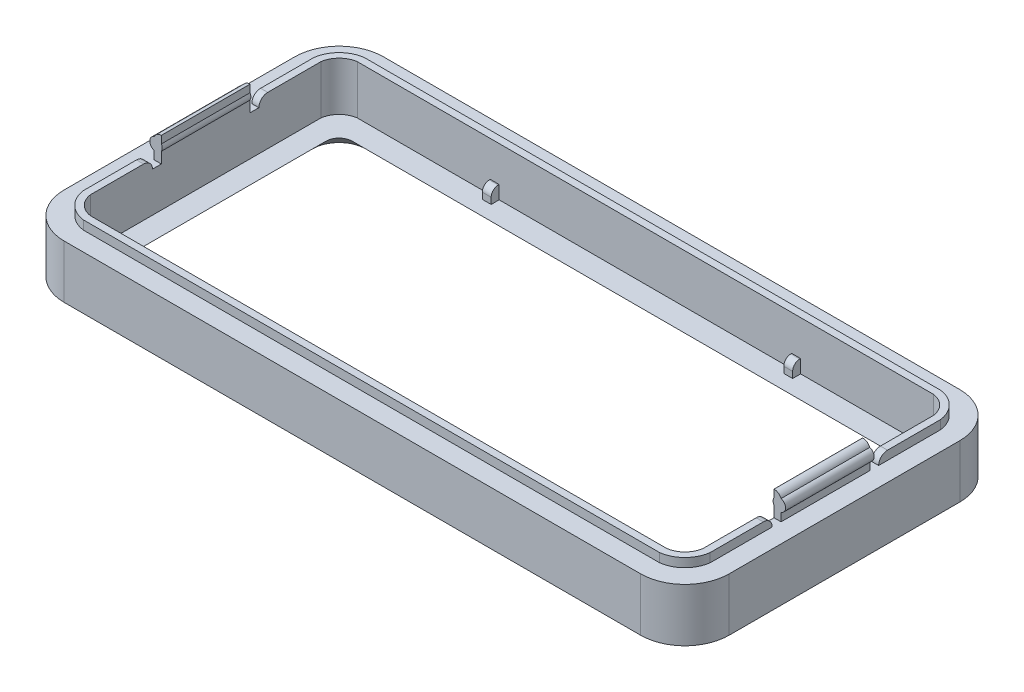
from build123d import *

# Parameters (mm, degrees)
EXTRUDE_2_DEPTH     = 6
EXTRUDE_4_DEPTH     = 1
SKETCH_7_W          = 0.8
SKETCH_7_H          = 10
EXTRUDE_8_DEPTH     = 2.8
SKETCH_8_R          = 0.7
EXTRUDE_9_DEPTH     = 10
FILLET_1_R          = 0.85
SKETCH_11_W         = 1
SKETCH_11_H         = 1
CUT_EXTRUDE_1_DEPTH = 1.2
FILLET_2_R          = 1
SKETCH_13_W         = 0.8
SKETCH_13_H         = 10
EXTRUDE_10_DEPTH    = 1.8
SKETCH_14_R         = 0.7
EXTRUDE_11_DEPTH    = 10
FILLET_3_R          = 0.85
SKETCH_15_W         = 0.8
SKETCH_15_H         = 1
CUT_EXTRUDE_3_DEPTH = 1
FILLET_4_R          = 1
CUT_EXTRUDE_START   = -4.5
CUT_EXTRUDE_4_DEPTH = 4.5
SKETCH_17_W         = 64
SKETCH_17_H         = 25
CUT_EXTRUDE_5_DEPTH = 1.5
FILLET_5_R          = 1.5
SKETCH_20_W         = 1
SKETCH_20_H         = 0.9
EXTRUDE_14_DEPTH    = 1.5
FILLET_8_R          = 0.8
CHAMFER_3_SIZE      = 1.5


# Some blends are built 0.0001 mm under size
with BuildPart() as part:
    # case 2 → 凸台-拉伸2 (new body)
    with BuildSketch(Plane(origin=(0, 0, 0), x_dir=(1, 0, 0), z_dir=(0, 1, 0))):
        with BuildLine():
            Line((-34.042196447, 18), (30.957803553, 18))
            ThreePointArc((30.957803553, 18), (34.493337459, 16.535533906), (35.957803553, 13))
            Line((35.957803553, 13), (35.957803553, -13))
            ThreePointArc((35.957803553, -13), (34.493337459, -16.535533906), (30.957803553, -18))
            Line((30.957803553, -18), (-34.042196447, -18))
            ThreePointArc((-34.042196447, -18), (-37.577730353, -16.535533906), (-39.042196447, -13))
            Line((-39.042196447, -13), (-39.042196447, 13))
            ThreePointArc((-39.042196447, 13), (-37.577730353, 16.535533906), (-34.042196447, 18))
        make_face()
    extrude(amount=EXTRUDE_2_DEPTH)

    # 草图3 → 凸台-拉伸4 (add)
    with BuildSketch(Plane(origin=(0, 6, 0), x_dir=(1, 0, 0), z_dir=(0, 1, 0))):
        with BuildLine():
            Line((-36.892196447, 13), (-36.892196447, -13))
            ThreePointArc((-36.892196447, -13), (-35.952846076, -14.910649629), (-34.042196447, -15.85))
            Line((-34.042196447, -15.85), (30.957803553, -15.85))
            ThreePointArc((30.957803553, -15.85), (32.868453181, -14.910649629), (33.807803553, -13))
            Line((33.807803553, -13), (33.807803553, 13))
            ThreePointArc((33.807803553, 13), (32.868453181, 14.910649629), (30.957803553, 15.85))
            Line((30.957803553, 15.85), (-34.042196447, 15.85))
            ThreePointArc((-34.042196447, 15.85), (-35.952846076, 14.910649629), (-36.892196447, 13))
        make_face()
        with BuildLine():
            Line((-34.042196447, -15.05), (30.957803553, -15.05))
            ThreePointArc((30.957803553, -15.05), (32.327315928, -14.369512375), (33.007803553, -13))
            Line((33.007803553, -13), (33.007803553, 13))
            ThreePointArc((33.007803553, 13), (32.327315928, 14.369512375), (30.957803553, 15.05))
            Line((30.957803553, 15.05), (-34.042196447, 15.05))
            ThreePointArc((-34.042196447, 15.05), (-35.411708823, 14.369512375), (-36.092196447, 13))
            Line((-36.092196447, 13), (-36.092196447, -13))
            ThreePointArc((-36.092196447, -13), (-35.411708823, -14.369512375), (-34.042196447, -15.05))
        make_face(mode=Mode.SUBTRACT)
    extrude(amount=EXTRUDE_4_DEPTH)

    # 草图7 → 凸台-拉伸8 (add)
    with BuildSketch(Plane(origin=(0, 6, 0), x_dir=(1, 0, 0), z_dir=(0, 1, 0))):
        with Locations((-36.492196447, 0)):
            Rectangle(SKETCH_7_W, SKETCH_7_H)
    extrude(amount=EXTRUDE_8_DEPTH)

    # 草图8 → 凸台-拉伸9 (add)
    with BuildSketch(Plane.XY.offset(5)):
        with Locations((-36.692196447, 7.6)):
            Circle(SKETCH_8_R)
    extrude(amount=-EXTRUDE_9_DEPTH)

    # 圆角1
    # the kernel refuses this fillet: 0.85 mm, written as the material it takes off along each edge
    with BuildSketch(Plane(origin=(-36.892196447, 8.8, 6.967826014), x_dir=(0, -1, 0), z_dir=(0, 0, -1))) as fillet_1_piece_1:
        with BuildLine():
            CenterArc((0.85, -0.787130406), FILLET_1_R, 112.174937704, 67.825062296)
            Line((0, -0.787130406), (-0.017, -0.787130406))
            Line((-0.017, -0.787130406), (-0.017, 0))
            Line((-0.017, 0), (0, 0.017))
            ThreePointArc((0, 0.017), (0.264589803, 0.017), (0.522763199, 0.015742608))
            Line((0.522763199, 0.015742608), (0.529179607, 0))
        make_face()
    extrude(amount=13.935652028, mode=Mode.SUBTRACT)

    # 草图11 → 切除-拉伸1 (cut)
    with BuildSketch(Plane.ZY.offset(36.892196447)):
        with Locations((5.5, 6.5)):
            Rectangle(SKETCH_11_W, SKETCH_11_H)
        with Locations((-5.5, 6.5)):
            Rectangle(SKETCH_11_W, SKETCH_11_H)
    extrude(amount=-CUT_EXTRUDE_1_DEPTH, mode=Mode.SUBTRACT)

    # 圆角2
    fillet_2_edges = [part.edges().sort_by_distance(p)[0] for p in [
        (-36.492196447, 7, 6),
        (-36.492196447, 7, -6),
    ]]
    fillet(fillet_2_edges, radius=FILLET_2_R - 0.0001)  # a hair under: the kernel refuses the full size

    # 草图13 → 凸台-拉伸10 (add)
    with BuildSketch(Plane(origin=(0, 7, 0), x_dir=(1, 0, 0), z_dir=(0, 1, 0))):
        with Locations((33.407803553, 0)):
            Rectangle(SKETCH_13_W, SKETCH_13_H)
    extrude(amount=EXTRUDE_10_DEPTH)

    # 草图14 → 凸台-拉伸11 (add)
    with BuildSketch(Plane.XY.offset(5)):
        with Locations((33.607803553, 7.6)):
            Circle(SKETCH_14_R)
    extrude(amount=-EXTRUDE_11_DEPTH)

    # 圆角3
    # the kernel refuses this fillet: 0.85 mm, written as the material it takes off along each edge
    with BuildSketch(Plane(origin=(33.807803553, 8.8, -6.967826014), x_dir=(0, -1, 0), z_dir=(0, 0, 1))) as fillet_3_piece_1:
        with BuildLine():
            CenterArc((0.85, -0.787130406), FILLET_3_R, 112.174937704, 67.825062296)
            Line((0, -0.787130406), (-0.017, -0.787130406))
            Line((-0.017, -0.787130406), (-0.017, 0))
            Line((-0.017, 0), (0, 0.017))
            ThreePointArc((0, 0.017), (0.264589803, 0.017), (0.522763199, 0.015742608))
            Line((0.522763199, 0.015742608), (0.529179607, 0))
        make_face()
    extrude(amount=13.935652028, mode=Mode.SUBTRACT)

    # 草图15 → 切除-拉伸3 (cut)
    with BuildSketch(Plane(origin=(0, 7, 0), x_dir=(1, 0, 0), z_dir=(0, 1, 0))):
        with Locations((33.407803553, 5.5)):
            Rectangle(SKETCH_15_W, SKETCH_15_H)
        with Locations((33.407803553, -5.5)):
            Rectangle(SKETCH_15_W, SKETCH_15_H)
    extrude(amount=-CUT_EXTRUDE_3_DEPTH, mode=Mode.SUBTRACT)

    # 圆角4
    fillet_4_edges = [part.edges().sort_by_distance(p)[0] for p in [
        (33.407803553, 7, 6),
        (33.407803553, 7, -6),
    ]]
    fillet(fillet_4_edges, radius=FILLET_4_R - 0.0001)  # a hair under: the kernel refuses the full size

    # 草图16 → 切除-拉伸4 (cut)
    with BuildSketch(Plane(origin=(0, 6, 0), x_dir=(1, 0, 0), z_dir=(0, 1, 0)).offset(CUT_EXTRUDE_START)):
        with BuildLine():
            Line((-34.042196447, -15.05), (30.957803553, -15.05))
            ThreePointArc((30.957803553, -15.05), (32.327315928, -14.369512375), (33.007803553, -13))
            Line((33.007803553, -13), (33.007803553, 13))
            ThreePointArc((33.007803553, 13), (32.327315928, 14.369512375), (30.957803553, 15.05))
            Line((30.957803553, 15.05), (-34.042196447, 15.05))
            ThreePointArc((-34.042196447, 15.05), (-35.411708823, 14.369512375), (-36.092196447, 13))
            Line((-36.092196447, 13), (-36.092196447, -13))
            ThreePointArc((-36.092196447, -13), (-35.411708823, -14.369512375), (-34.042196447, -15.05))
        make_face()
    extrude(amount=CUT_EXTRUDE_4_DEPTH, mode=Mode.SUBTRACT)

    # 草图17 → 切除-拉伸5 (cut)
    with BuildSketch(Plane(origin=(0, 1.5, 0), x_dir=(1, 0, 0), z_dir=(0, 1, 0))):
        with Locations((-1.542196447, 0)):
            Rectangle(SKETCH_17_W, SKETCH_17_H)
    extrude(amount=-CUT_EXTRUDE_5_DEPTH, mode=Mode.SUBTRACT)

    # 圆角5
    fillet_5_edges = [part.edges().sort_by_distance(p)[0] for p in [
        (-33.542196447, 0.75, 12.5),
        (-33.542196447, 0.75, -12.5),
        (30.457803553, 0.75, -12.5),
        (30.457803553, 0.75, 12.5),
    ]]
    fillet(fillet_5_edges, radius=FILLET_5_R)

    # 草图20 → 凸台-拉伸14 (add)
    with BuildSketch(Plane(origin=(0, 1.5, 0), x_dir=(1, 0, 0), z_dir=(0, 1, 0))):
        with Locations((-18.542196447, 14.6)):
            Rectangle(SKETCH_20_W, SKETCH_20_H)
        with Locations((15.457803553, 14.6)):
            Rectangle(SKETCH_20_W, SKETCH_20_H)
        with Locations((-18.542196447, -14.6)):
            Rectangle(SKETCH_20_W, SKETCH_20_H)
        with Locations((15.457803553, -14.6)):
            Rectangle(SKETCH_20_W, SKETCH_20_H)
    extrude(amount=EXTRUDE_14_DEPTH)

    # 圆角8
    fillet_8_edges = [part.edges().sort_by_distance(p)[0] for p in [
        (-18.542196447, 3, -14.15),
        (15.457803553, 3, -14.15),
        (-18.542196447, 3, 14.15),
        (15.457803553, 3, 14.15),
    ]]
    fillet(fillet_8_edges, radius=FILLET_8_R)

    # 倒角3
    chamfer_3_edges = [part.edges().sort_by_distance(p)[0] for p in [
        (-1.542196447, 0, -12.5),
        (-33.102856619, 0, -12.060660172),
        (30.018463725, 0, -12.060660172),
        (-33.542196447, 0, 0),
        (30.457803553, 0, 0),
        (-33.102856619, 0, 12.060660172),
        (30.018463725, 0, 12.060660172),
        (-1.542196447, 0, 12.5),
    ]]
    chamfer(chamfer_3_edges, length=CHAMFER_3_SIZE - 0.0001)  # a hair under: the kernel refuses the full size


solid = part.part
